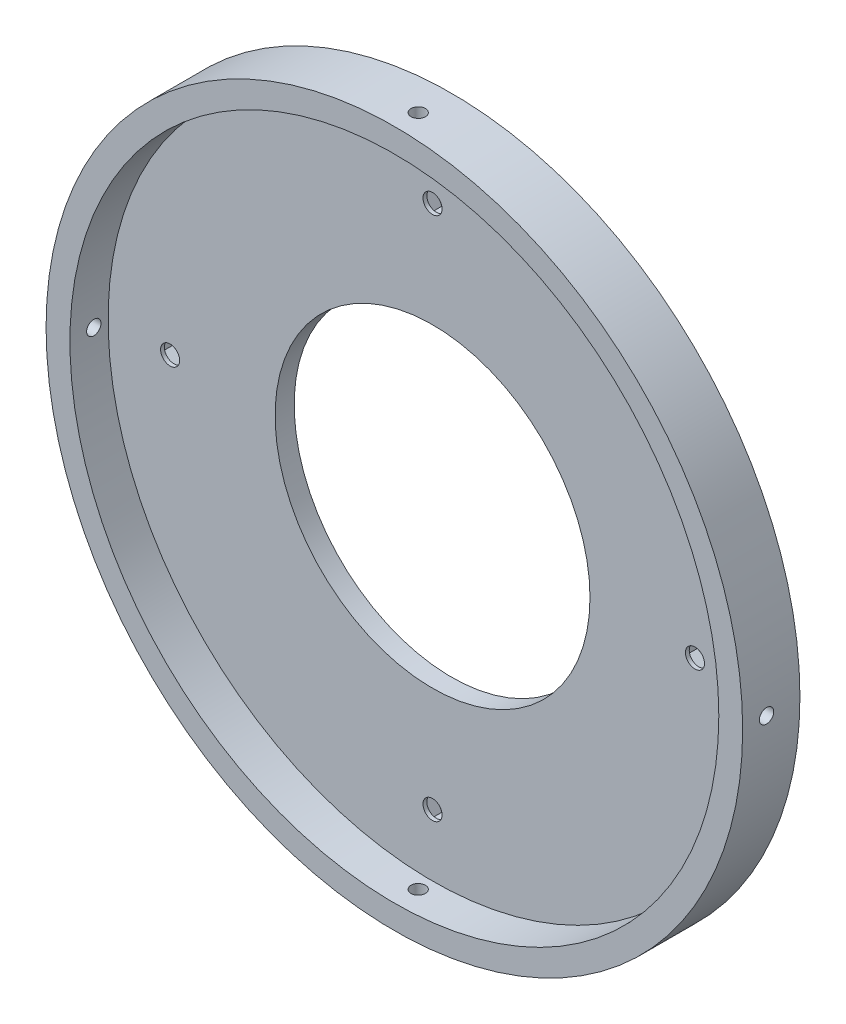
from build123d import *

# Parameters (mm, degrees)
SKETCH1_R               = 73
SKETCH1_R_2             = 33
BOSS_EXTRUDE1_DEPTH     = 4
SKETCH2_R               = 73
SKETCH2_R_2             = 68
BOSS_EXTRUDE2_DEPTH     = 8
CUT_EXTRUDE1_REACH      = 105.933
CUT_EXTRUDE1_END_RADIUS = 73
SKETCH3_R               = 1.5
CIRPATTERN1_COUNT       = 4
F_4_0MM_DOWEL_HOLE1_D   = 4
CUT_EXTRUDE2_DEPTH      = 3.2


with BuildPart() as part:
    # Sketch1 → Boss-Extrude1 (new body)
    with BuildSketch(Plane.XY):
        Circle(SKETCH1_R)
        Circle(SKETCH1_R_2, mode=Mode.SUBTRACT)
    extrude(amount=BOSS_EXTRUDE1_DEPTH)

    # Sketch2 → Boss-Extrude2 (add)
    with BuildSketch(Plane.XY.offset(4)):
        Circle(SKETCH2_R)
        Circle(SKETCH2_R_2, mode=Mode.SUBTRACT)
    extrude(amount=BOSS_EXTRUDE2_DEPTH)

    # Cut-Extrude1: up to this cylinder (the profile starts inside it)
    cut_extrude1_end = Plane(origin=(0, 0, 7), z_dir=(0, 0, -1)) * Cylinder(CUT_EXTRUDE1_END_RADIUS, 358.866, mode=Mode.PRIVATE)
    # Sketch3 → Cut-Extrude1 (cut, up to the surface)
    with BuildSketch(Plane(origin=(0, 0, 0), x_dir=(1, 0, 0), z_dir=(0, 1, 0)), mode=Mode.PRIVATE) as cut_extrude1_sk1:
        with Locations((0, -7)):
            Circle(SKETCH3_R)
    cut_extrude1_tool1 = extrude(cut_extrude1_sk1.sketch, amount=-CUT_EXTRUDE1_REACH, mode=Mode.PRIVATE) & cut_extrude1_end
    cut_extrude1 = cut_extrude1_tool1.solids().sort_by_distance((0, 0, 7))[0]
    add(cut_extrude1, mode=Mode.SUBTRACT)

    # CirPattern1: Cut-Extrude1 ×4 about axis
    cirpattern1_axis = Axis((0, 0, 4), (0, 0, -1))
    for i in range(1, CIRPATTERN1_COUNT):
        add(cut_extrude1.rotate(cirpattern1_axis, i * 360 / CIRPATTERN1_COUNT), mode=Mode.SUBTRACT)

    # Ø4.0mm Dowel Hole1 (through all)
    with Locations(Plane(origin=(0, 0, 0), x_dir=(-1, 0, 0), z_dir=(0, 0, -1))):
        with Locations((0, 55), (55, 0), (0, -55), (-55, 0)):
            Hole(F_4_0MM_DOWEL_HOLE1_D / 2)

    # Sketch13 → Cut-Extrude2 (cut)
    with BuildSketch(Plane(origin=(0, 0, 0), x_dir=(-1, 0, 0), z_dir=(0, 0, -1))):
        Polygon((4.041451884, 55), (2.020725942, 58.5), (-2.020725942, 58.5), (-4.041451884, 55), (-2.020725942, 51.5), (2.020725942, 51.5), align=None)
        Polygon((55, -4.041451884), (58.5, -2.020725942), (58.5, 2.020725942), (55, 4.041451884), (51.5, 2.020725942), (51.5, -2.020725942), align=None)
        Polygon((-4.041451884, -55), (-2.020725942, -58.5), (2.020725942, -58.5), (4.041451884, -55), (2.020725942, -51.5), (-2.020725942, -51.5), align=None)
        Polygon((-55, 4.041451884), (-58.5, 2.020725942), (-58.5, -2.020725942), (-55, -4.041451884), (-51.5, -2.020725942), (-51.5, 2.020725942), align=None)
    extrude(amount=-CUT_EXTRUDE2_DEPTH, mode=Mode.SUBTRACT)


solid = part.part
